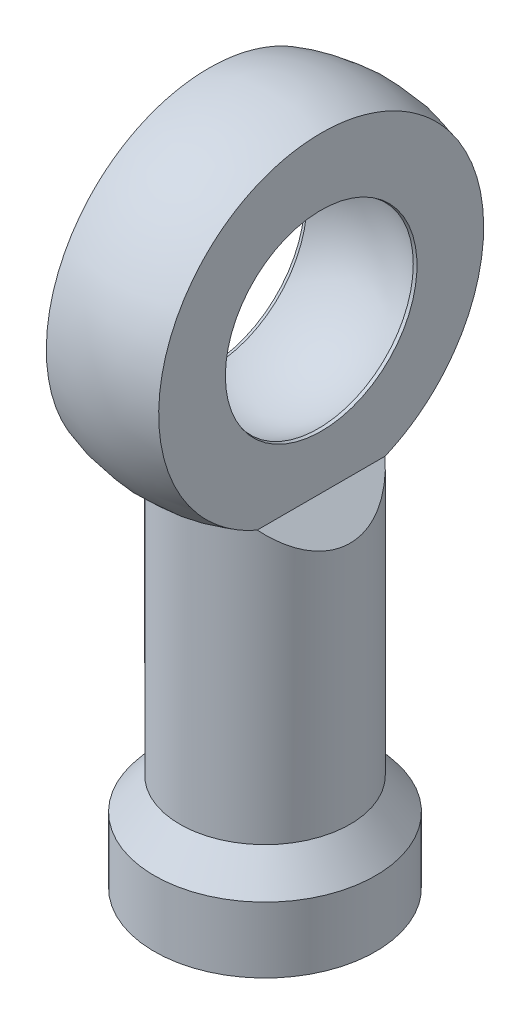
from build123d import *

# Parameters (mm, degrees)
CORTAR_EXTRUIR1_DEPTH      = 34.678925161
CORTAR_EXTRUIR1_DEPTH_BACK = 34.678925161
CROQUIS5_R                 = 3
CORTAR_EXTRUIR3_DEPTH      = 22
REDONDEO5_R                = 0.3
CHAFL_N1_SIZE              = 0.145725928


with BuildPart() as part:
    # Croquis1 → Revolución1 (revolve)
    with BuildSketch(Plane.XY):
        with BuildLine():
            Line((-5, -8.775534172), (-5, -24.775534172))
            Line((-5, -24.775534172), (-6.5, -26.638122331))
            Line((-6.5, -26.638122331), (-6.5, -30.5))
            Line((-6.5, -30.5), (0, -30.5))
            Line((0, -30.5), (0, -6.4))
            ThreePointArc((0, -6.4), (-6.4, 0), (0, 6.4))
            Line((0, 6.4), (0, 10.1))
            ThreePointArc((0, 10.1), (-9.763270332, 2.586223585), (-5, -8.775534172))
        make_face()
    revolve(axis=Axis((0, -6.4, 0), (0, -1, 0)))

    # Croquis2 → Cortar-Extruir1 (cut, two sides: drawn at the far end of the back side and taken through both)
    with BuildSketch(Plane.XY.offset(-CORTAR_EXTRUIR1_DEPTH_BACK)):
        Polygon((6.3, -11.775534172), (3.3, -8.775534172), (3.3, 15.005915622), (11.326938796, 15.005915622), (10.720239286, -11.775534172), align=None)
        Polygon((-3.3, -8.775534172), (-3.3, 15.005915622), (-11.844039482, 15.005915622), (-11.844039482, -11.775534172), (-6.3, -11.775534172), align=None)
    extrude(amount=CORTAR_EXTRUIR1_DEPTH + CORTAR_EXTRUIR1_DEPTH_BACK, mode=Mode.SUBTRACT)

    # Croquis5 → Cortar-Extruir3 (cut)
    with BuildSketch(Plane.XZ.offset(30.5)):
        Circle(CROQUIS5_R)
    extrude(amount=-CORTAR_EXTRUIR3_DEPTH, mode=Mode.SUBTRACT)

    # Redondeo5
    redondeo5_edges = [part.edges().sort_by_distance(p)[0] for p in [
        (-3, -30.5, 0),
    ]]
    fillet(redondeo5_edges, radius=REDONDEO5_R)

    # Chaflán1
    # the kernel refuses this chamfer: 0.2, 0.145725928 mm, written as the material it takes off along each edge
    with BuildSketch(Plane(origin=(3.3, 0, 0), x_dir=(0, 0, -1), z_dir=(0, 1, 0))) as chafl_n1_piece_1:
        with BuildLine():
            Line((5.483611948 + CHAFL_N1_SIZE * 0.999999998153, 0), (5.585635764, 0.175792403))
            ThreePointArc((5.585635764, 0.175792403), (5.536764117, 0.089977708), (5.483611948, 0))
            Line((5.483611948, 0), (5.483611948 + CHAFL_N1_SIZE * 0.999999998153, 0))
        make_face()
    revolve(axis=Axis((3.3, 0, 0), (-1, 0, 0)), mode=Mode.SUBTRACT)
    with BuildSketch(Plane(origin=(-3.3, 0, 0), x_dir=(0, 1, 0), z_dir=(0, 0, 1))) as chafl_n1_piece_2:
        with BuildLine():
            Line((5.483611948 + CHAFL_N1_SIZE * 0.999999998153, 0), (5.585635764, -0.175792403))
            ThreePointArc((5.585635764, -0.175792403), (5.536764117, -0.089977708), (5.483611948, 0))
            Line((5.483611948, 0), (5.483611948 + CHAFL_N1_SIZE * 0.999999998153, 0))
        make_face()
    revolve(axis=Axis((-3.3, 0, 0), (-1, 0, 0)), revolution_arc=180, mode=Mode.SUBTRACT)
    with BuildSketch(Plane(origin=(-3.3, 0, 0), x_dir=(0, -1, 0), z_dir=(0, 0, -1))) as chafl_n1_piece_3:
        with BuildLine():
            Line((5.483611948 + CHAFL_N1_SIZE * 0.999999998153, 0), (5.585635764, -0.175792403))
            ThreePointArc((5.585635764, -0.175792403), (5.536764117, -0.089977708), (5.483611948, 0))
            Line((5.483611948, 0), (5.483611948 + CHAFL_N1_SIZE * 0.999999998153, 0))
        make_face()
    revolve(axis=Axis((-3.3, 0, 0), (-1, 0, 0)), revolution_arc=180, mode=Mode.SUBTRACT)


solid = part.part
